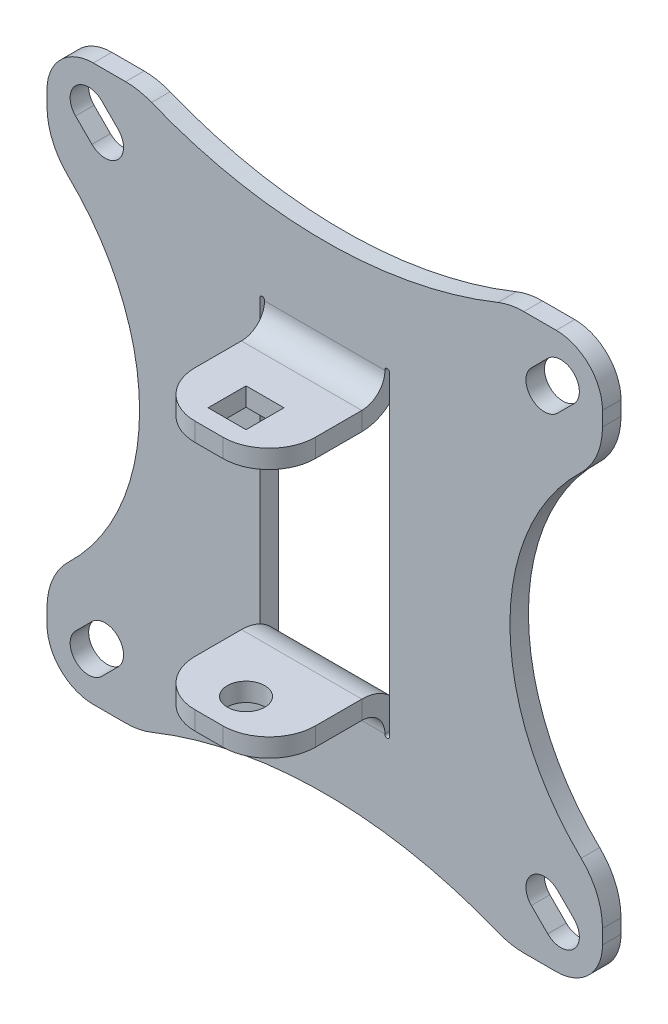
from build123d import *

# Parameters (mm, degrees)
SKETCH_1_W                   = 120
SKETCH_1_H                   = 120
SKETCH_1_W_2                 = 28
SKETCH_1_H_2                 = 50
SM_BASE_FLANGE_1_DEPTH       = 4
SM_START                     = -5
SM_EDGE_FLANGE_1_DEPTH       = 10
SM_EDGE_FLANGE_1_2_OUTLINE_W = 26
SM_EDGE_FLANGE_1_2_OUTLINE_H = 4
SM_EDGE_FLANGE_1_2_DEPTH     = 1.41096
SM_START_2                   = 5
SM_EDGE_FLANGE_1_3_OUTLINE_W = 26
SM_EDGE_FLANGE_1_3_OUTLINE_H = 4
SM_EDGE_FLANGE_1_3_DEPTH     = 20
SM_START_3                   = -13
SM_EDGE_FLANGE_1_4_DEPTH     = 26
SM_EDGE_FLANGE_1_5_DEPTH     = 26
CUT_EXTRUDE_1_DEPTH          = 89.459030065
CUT_EXTRUDE_1_DEPTH_BACK     = 89.459030065
SKETCH_10_R                  = 4.05
SKETCH_12_W                  = 8.2
SKETCH_12_H                  = 8.2
CUT_EXTRUDE_3_DEPTH          = 4
FILLET_1_R                   = 10
SKETCH_11_R                  = 4
CUT_EXTRUDE_2_DEPTH          = 4
CUT_EXTRUDE_4_DEPTH          = 4
CUT_EXTRUDE_5_DEPTH          = 4
FILLET_2_R                   = 15


with BuildPart() as part:
    # Базовая кромка1: sheet metal written as solids
    # Sketch 1 → Базовая кромка1 (new body)
    with BuildSketch(Plane.XY):
        Rectangle(SKETCH_1_W, SKETCH_1_H)
        Rectangle(SKETCH_1_W_2, SKETCH_1_H_2, mode=Mode.SUBTRACT)
    extrude(amount=-SM_BASE_FLANGE_1_DEPTH)

    # Ребро-кромка1: read off the stored shape, not the designer's step
    # Ребро-кромка1 outline → Ребро-кромка1 (cut)
    with BuildSketch(Plane.XY.offset(SM_START)):
        with BuildLine():
            ThreePointArc((-13, 34.1), (-13.5, 34.6), (-14, 34.1))
            Line((-14, 34.1), (-14, 25))
            Line((-14, 25), (-13, 25))
            Line((-13, 25), (-13, 34.1))
        make_face()
        with BuildLine():
            Line((-13, -25), (-14, -25))
            Line((-14, -25), (-14, -34.1))
            ThreePointArc((-14, -34.1), (-13.5, -34.6), (-13, -34.1))
            Line((-13, -34.1), (-13, -25))
        make_face()
        with BuildLine():
            Line((13, 34.1), (13, 25))
            Line((13, 25), (14, 25))
            Line((14, 25), (14, 34.1))
            ThreePointArc((14, 34.1), (13.5, 34.6), (13, 34.1))
        make_face()
        with BuildLine():
            Line((14, -25), (13, -25))
            Line((13, -25), (13, -34.1))
            ThreePointArc((13, -34.1), (13.5, -34.6), (14, -34.1))
            Line((14, -34.1), (14, -25))
        make_face()
    extrude(amount=SM_EDGE_FLANGE_1_DEPTH, mode=Mode.SUBTRACT)

    # Sm Edge Flange 1 2 outline → Sm Edge Flange 1 2 (cut)
    with BuildSketch(Plane.XY.offset(SM_START)):
        with Locations((0, 27)):
            Rectangle(SM_EDGE_FLANGE_1_2_OUTLINE_W, SM_EDGE_FLANGE_1_2_OUTLINE_H)
        with Locations((0, -27)):
            Rectangle(SM_EDGE_FLANGE_1_2_OUTLINE_W, SM_EDGE_FLANGE_1_2_OUTLINE_H)
    extrude(amount=SM_EDGE_FLANGE_1_2_DEPTH, mode=Mode.SUBTRACT)

    # Sm Edge Flange 1 4 outline → Sm Edge Flange 1 4 (cut)
    with BuildSketch(Plane.YZ.offset(SM_START_3)):
        with BuildLine():
            ThreePointArc((34, -4), (29.757359313, -2.937253933), (26.516685226, 0))
            Line((26.516685226, 0), (25, 0))
            Line((25, 0), (25, -3.58904))
            Line((25, -3.58904), (29, -3.58904))
            Line((29, -3.58904), (29, -4))
            Line((29, -4), (34, -4))
        make_face()
        with BuildLine():
            Line((-25, -3.58904), (-25, 0))
            Line((-25, 0), (-26.516685226, 0))
            ThreePointArc((-26.516685226, 0), (-29.757359313, -2.937253933), (-34, -4))
            Line((-34, -4), (-29, -4))
            Line((-29, -4), (-29, -3.58904))
            Line((-29, -3.58904), (-25, -3.58904))
        make_face()
    extrude(amount=SM_EDGE_FLANGE_1_4_DEPTH, mode=Mode.SUBTRACT)



with BuildPart() as body_2:
    # Sm Edge Flange 1 3 outline → Sm Edge Flange 1 3 (new body)
    with BuildSketch(Plane.XY.offset(SM_START_2)):
        with Locations((0, 27)):
            Rectangle(SM_EDGE_FLANGE_1_3_OUTLINE_W, SM_EDGE_FLANGE_1_3_OUTLINE_H)
        with Locations((0, -27)):
            Rectangle(SM_EDGE_FLANGE_1_3_OUTLINE_W, SM_EDGE_FLANGE_1_3_OUTLINE_H)
    extrude(amount=SM_EDGE_FLANGE_1_3_DEPTH)


with BuildPart() as part_1:
    add(part.part)

    add(body_2.part)  # Sm Edge Flange 1 5 merges body 2
    # Sm Edge Flange 1 5 outline → Sm Edge Flange 1 5 (add)
    with BuildSketch(Plane.YZ.offset(SM_START_3)):
        with BuildLine():
            Line((29, 5), (25, 5))
            ThreePointArc((25, 5), (25.38751392, 2.38751392), (26.516685226, 0))
            Line((26.516685226, 0), (34, 0))
            ThreePointArc((34, 0), (30.464466094, 1.464466094), (29, 5))
        make_face()
        with BuildLine():
            Line((-34, 0), (-26.516685226, 0))
            ThreePointArc((-26.516685226, 0), (-25.38751392, 2.38751392), (-25, 5))
            Line((-25, 5), (-29, 5))
            ThreePointArc((-29, 5), (-30.464466094, 1.464466094), (-34, 0))
        make_face()
    extrude(amount=SM_EDGE_FLANGE_1_5_DEPTH)

    # Эскиз10 → Вырез-Вытянуть1 (cut, two sides: drawn at the far end of the back side and taken through both)
    with BuildSketch(Plane(origin=(0, 0, 0), x_dir=(1, 0, 0), z_dir=(0, 1, 0)).offset(-CUT_EXTRUDE_1_DEPTH_BACK)):
        with Locations(Location((0, -17, 0), (0, 0, 90))):
            Circle(SKETCH_10_R)
    extrude(amount=CUT_EXTRUDE_1_DEPTH + CUT_EXTRUDE_1_DEPTH_BACK, mode=Mode.SUBTRACT)

    # Эскиз12 → Вырез-Вытянуть3 (cut)
    with BuildSketch(Plane(origin=(0, 29, 0), x_dir=(1, 0, 0), z_dir=(0, 1, 0))):
        with Locations((0, -17)):
            Rectangle(SKETCH_12_W, SKETCH_12_H)
    extrude(amount=-CUT_EXTRUDE_3_DEPTH, mode=Mode.SUBTRACT)

    # Скругление1
    fillet_1_edges = [part_1.edges().sort_by_distance(p)[0] for p in [
        (13, -27, 25),
        (-13, -27, 25),
        (-60, 60, -2),
        (60, 60, -2),
        (60, -60, -2),
        (-60, -60, -2),
        (-13, 27, 25),
        (13, 27, 25),
    ]]
    fillet(fillet_1_edges, radius=FILLET_1_R)

    # Эскиз11 → Вырез-Вытянуть2 (cut)
    with BuildSketch(Plane.XY):
        with Locations((-51, 51)):
            Circle(SKETCH_11_R)
        with Locations((51, 51)):
            Circle(SKETCH_11_R)
        with Locations((-51, -51)):
            Circle(SKETCH_11_R)
        with Locations((51, -51)):
            Circle(SKETCH_11_R)
    extrude(amount=-CUT_EXTRUDE_2_DEPTH, mode=Mode.SUBTRACT)

    # Эскиз13 → Вырез-Вытянуть4 (cut)
    with BuildSketch(Plane.XY):
        with BuildLine():
            Line((-48.171572875, 53.828427125), (-44.636038969, 50.292893219))
            ThreePointArc((-44.636038969, 50.292893219), (-44.636038969, 44.636038969), (-50.292893219, 44.636038969))
            Line((-50.292893219, 44.636038969), (-53.828427125, 48.171572875))
            ThreePointArc((-53.828427125, 48.171572875), (-53.828427125, 53.828427125), (-48.171572875, 53.828427125))
        make_face()
        with BuildLine():
            Line((53.828427125, 48.171572875), (50.292893219, 44.636038969))
            ThreePointArc((50.292893219, 44.636038969), (44.636038969, 44.636038969), (44.636038969, 50.292893219))
            Line((44.636038969, 50.292893219), (48.171572875, 53.828427125))
            ThreePointArc((48.171572875, 53.828427125), (53.828427125, 53.828427125), (53.828427125, 48.171572875))
        make_face()
        with BuildLine():
            Line((-53.828427125, -48.171572875), (-50.292893219, -44.636038969))
            ThreePointArc((-50.292893219, -44.636038969), (-44.636038969, -44.636038969), (-44.636038969, -50.292893219))
            Line((-44.636038969, -50.292893219), (-48.171572875, -53.828427125))
            ThreePointArc((-48.171572875, -53.828427125), (-53.828427125, -53.828427125), (-53.828427125, -48.171572875))
        make_face()
        with BuildLine():
            Line((48.171572875, -53.828427125), (44.636038969, -50.292893219))
            ThreePointArc((44.636038969, -50.292893219), (44.636038969, -44.636038969), (50.292893219, -44.636038969))
            Line((50.292893219, -44.636038969), (53.828427125, -48.171572875))
            ThreePointArc((53.828427125, -48.171572875), (53.828427125, -53.828427125), (48.171572875, -53.828427125))
        make_face()
    extrude(amount=-CUT_EXTRUDE_4_DEPTH, mode=Mode.SUBTRACT)

    # Эскиз14 → Вырез-Вытянуть5 (cut)
    with BuildSketch(Plane.XY):
        with BuildLine():
            Line((-60, 40), (-60, -40))
            ThreePointArc((-60, -40), (-40, 0), (-60, 40))
        make_face()
        with BuildLine():
            Line((60, 40), (60, -40))
            ThreePointArc((60, -40), (40, 0), (60, 40))
        make_face()
        with BuildLine():
            Line((-40, 60), (40, 60))
            ThreePointArc((40, 60), (0, 51.651513899), (-40, 60))
        make_face()
        with BuildLine():
            Line((-40, -60), (40, -60))
            ThreePointArc((40, -60), (0, -51.651513899), (-40, -60))
        make_face()
    extrude(amount=-CUT_EXTRUDE_5_DEPTH, mode=Mode.SUBTRACT)

    # Скругление2
    fillet_2_edges = [part_1.edges().sort_by_distance(p)[0] for p in [
        (40, 60, -2),
        (-40, 60, -2),
        (60, -40, -2),
        (60, 40, -2),
        (-40, -60, -2),
        (40, -60, -2),
        (-60, 40, -2),
        (-60, -40, -2),
    ]]
    fillet(fillet_2_edges, radius=FILLET_2_R)


solid = part_1.part
